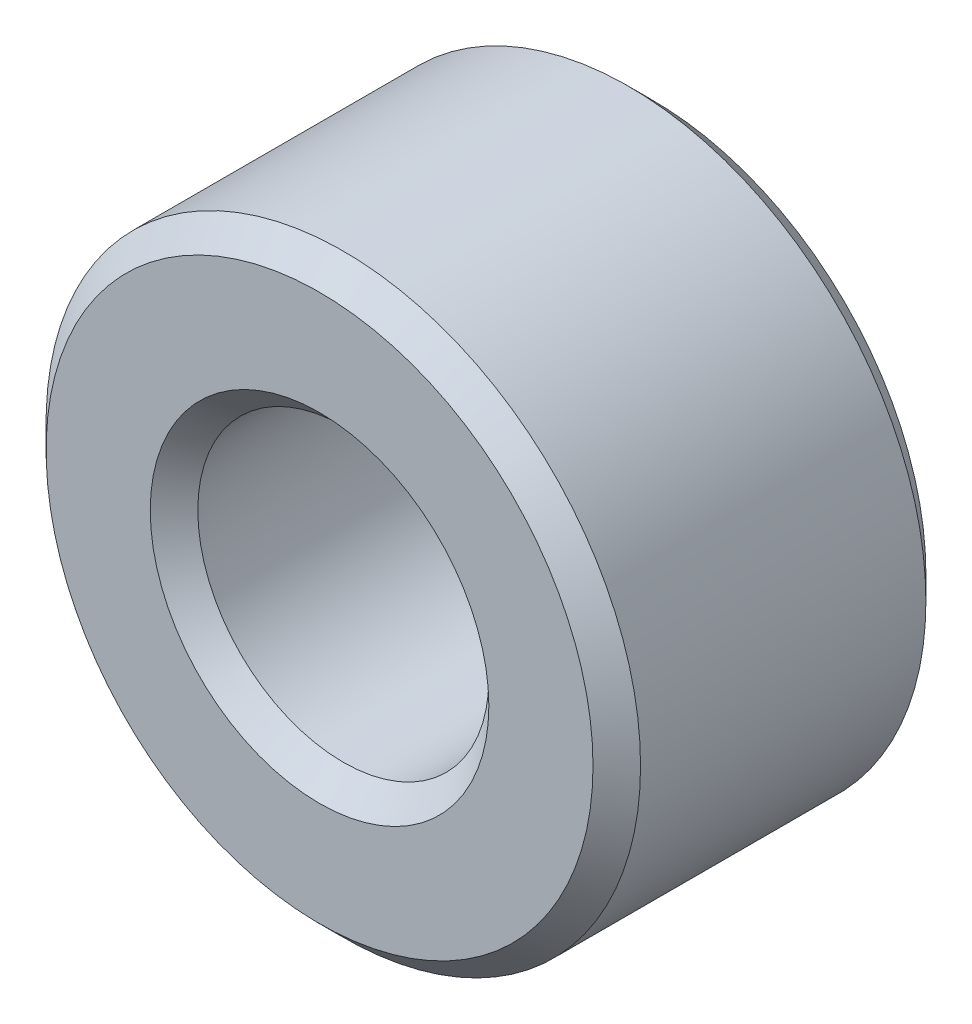
from build123d import *

# Parameters (mm, degrees)
SKETCH2_R             = 7.9375
SKETCH2_R_2           = 3.8862
BOSS_EXTRUDE1_DEPTH   = 6.35
SKETCH2_R_3           = 1.70815
BOSS_EXTRUDE1_2_DEPTH = 6.35
BOSS_EXTRUDE3_START   = -2.54
SKETCH2_6_R           = 7.9375
SKETCH2_6_R_2         = 1.70815
BOSS_EXTRUDE3_DEPTH   = 2.54
CHAMFER2_SIZE         = 1.27
CHAMFER2_SIZE2        = 1.513527063
CHAMFER3_SIZE         = 0.635


with BuildPart() as part:
    # Sketch2 → Boss-Extrude1 (new body)
    with BuildSketch(Plane(origin=(0, 0, 0), x_dir=(0, 1, 0), z_dir=(0, 0, 1))):
        Circle(SKETCH2_R)
        Circle(SKETCH2_R_2, mode=Mode.SUBTRACT)
    extrude(amount=BOSS_EXTRUDE1_DEPTH)

    # Sketch2<6> → Boss-Extrude3 (add)
    with BuildSketch(Plane(origin=(0, 0, 0), x_dir=(0, 1, 0), z_dir=(0, 0, 1)).offset(BOSS_EXTRUDE3_START)):
        Circle(SKETCH2_6_R)
        Circle(SKETCH2_6_R_2, mode=Mode.SUBTRACT)
    extrude(amount=BOSS_EXTRUDE3_DEPTH)

    # Chamfer2
    chamfer2_edges = [part.edges().sort_by_distance(p)[0] for p in [
        (0, -1.70815, -2.54),
    ]]
    chamfer2_side = [part.faces().sort_by_distance(p)[0] for p in [
        (0, -1.70815, -1.27),
    ]]
    chamfer(chamfer2_edges, length=CHAMFER2_SIZE, length2=CHAMFER2_SIZE2, reference=chamfer2_side[0])

    # Chamfer3
    chamfer3_edges = [part.edges().sort_by_distance(p)[0] for p in [
        (0, -3.8862, 6.35),
        (0, -7.9375, 6.35),
        (0, -7.9375, -2.54),
    ]]
    chamfer(chamfer3_edges, length=CHAMFER3_SIZE)


with BuildPart() as body_2:
    # Sketch2 → Boss-Extrude1 2 (new body)
    with BuildSketch(Plane(origin=(0, 0, 0), x_dir=(0, 1, 0), z_dir=(0, 0, 1))):
        Circle(SKETCH2_R_3)
    extrude(amount=BOSS_EXTRUDE1_2_DEPTH)


solid = part.part
